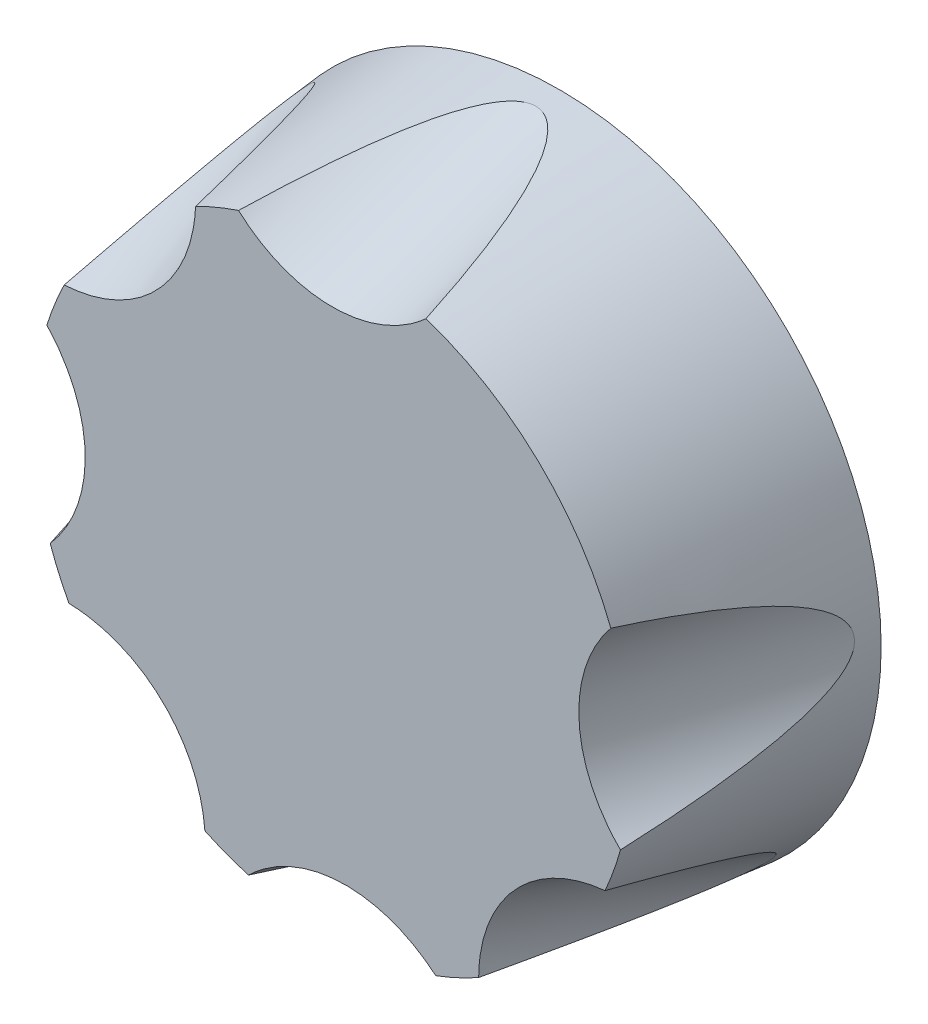
from build123d import *

# Parameters (mm, degrees)
REVOLVE1_ANGLE     = 19.5
CUT_EXTRUDE3_DEPTH = 30
REVOLVE2_ANGLE     = 19.5
CUT_EXTRUDE4_DEPTH = 30
REVOLVE3_ANGLE     = 19.5
CUT_EXTRUDE5_DEPTH = 30
REVOLVE4_ANGLE     = 19.5
CUT_EXTRUDE6_DEPTH = 30
REVOLVE5_ANGLE     = 19.5
CUT_EXTRUDE7_DEPTH = 30
REVOLVE6_ANGLE     = 19.5
CUT_EXTRUDE8_DEPTH = 30
REVOLVE7_ANGLE     = 19.5
CUT_EXTRUDE9_DEPTH = 30


# Read off the part's stored shape, not the designer's step: Boundary1
with BuildPart() as part:
    # Boundary1 outline → Boundary1 (revolve)
    with BuildSketch(Plane.XZ):
        Polygon((23.4, 0), (21.75, 16.55), (0, 16.55), (0, 0), align=None)
    revolve(axis=Axis((0, 0, 0), (0, 0, 1)))

    # Sketch3 → Revolve1 (revolve)
    with BuildSketch(Plane.XY.offset(16.55)):
        with BuildLine():
            ThreePointArc((6.7, 20.692329497), (0, 21.75), (-6.7, 20.692329497))
            ThreePointArc((-6.7, 20.692329497), (0, 18.897069907), (6.7, 20.692329497))
        make_face()
    revolve(axis=Axis((-21.75, 0, 16.55), (1, 0, 0)), revolution_arc=REVOLVE1_ANGLE)

    # Sketch21 → Cut-Extrude3 (cut)
    # profile 1 of 2: a face of its own
    with BuildSketch(Plane(origin=(0, -5.207626236, 14.705882831), x_dir=(1, 0, 0), z_dir=(0, -0.3338068592337716, 0.9426414910921781))):
        with BuildLine():
            Line((9.372530559, 28.241040631), (-9.372530559, 28.241040631))
            ThreePointArc((-9.372530559, 28.241040631), (0, 22.47450352), (9.372530559, 28.241040631))
        make_face()
        with BuildLine():
            ThreePointArc((6.7, 26.216833017), (0, 24.421573428), (-6.7, 26.216833017))
            ThreePointArc((-6.7, 26.216833017), (0, 27.27450352), (6.7, 26.216833017))
        make_face(mode=Mode.SUBTRACT)
    # profile 2 of 2: a face of its own
    with BuildSketch(Plane(origin=(0, -5.207626236, 14.705882831), x_dir=(1, 0, 0), z_dir=(0, -0.3338068592337716, 0.9426414910921781))):
        with BuildLine():
            ThreePointArc((6.7, 26.216833017), (0, 27.27450352), (-6.7, 26.216833017))
            ThreePointArc((-6.7, 26.216833017), (0, 24.421573428), (6.7, 26.216833017))
        make_face()
    extrude(amount=-CUT_EXTRUDE3_DEPTH, mode=Mode.SUBTRACT)

    # Sketch22 → Revolve2 (revolve)
    with BuildSketch(Plane.XY.offset(16.55)):
        with BuildLine():
            ThreePointArc((-19.454905378, 9.724667435), (-15.513197269, 15.244776499), (-10.062721237, 19.282223454))
            ThreePointArc((-10.062721237, 19.282223454), (-13.478343599, 13.245131366), (-19.454905378, 9.724667435))
        make_face()
    revolve(axis=Axis((-15.244776499, -15.513197269, 16.55), (0.7009092642998491, 0.7132504491541835, 0)), revolution_arc=REVOLVE2_ANGLE)

    # Sketch24 → Cut-Extrude4 (cut)
    with BuildSketch(Plane(origin=(3.714341752, -3.650073474, 14.705882831), x_dir=(0.971243492060928, 0.05687022863046558, -0.23119657485527895), z_dir=(0.23808789227923496, -0.23396832012378627, 0.9426414910921782))):
        with BuildLine():
            Line((-27.491870021, 14.371370891), (-13.585471932, 28.745378411))
            ThreePointArc((-13.585471932, 28.745378411), (-15.293280927, 16.483625521), (-27.491870021, 14.371370891))
        make_face()
    extrude(amount=-CUT_EXTRUDE4_DEPTH, mode=Mode.SUBTRACT)

    # Sketch25 → Revolve3 (revolve)
    with BuildSketch(Plane.XY.offset(16.55)):
        with BuildLine():
            ThreePointArc((-20.571898581, -7.061125177), (-21.74668737, -0.37958984), (-20.805796451, 6.338874823))
            ThreePointArc((-20.805796451, 6.338874823), (-18.893272141, -0.329783292), (-20.571898581, -7.061125177))
        make_face()
    revolve(axis=Axis((0.37958984, -21.74668737, 16.55), (-0.017452406437287054, 0.9998476951563913, 0)), revolution_arc=REVOLVE3_ANGLE)

    # Sketch26 → Cut-Extrude5 (cut)
    with BuildSketch(Plane(origin=(5.206833089, 0.09088561, 14.705882831), x_dir=(0.9426574907513692, -0.004123731024087582, -0.3337361981757048), z_dir=(0.33375601883228045, 0.00582573297890205, 0.9426414910921782))):
        with BuildLine():
            Line((-29.354887322, 9.164887842), (-30.256162535, -10.835112158))
            ThreePointArc((-30.256162535, -10.835112158), (-22.482645188, -1.165108658), (-29.354887322, 9.164887842))
        make_face()
    extrude(amount=-CUT_EXTRUDE5_DEPTH, mode=Mode.SUBTRACT)

    # Sketch27 → Revolve4 (revolve)
    with BuildSketch(Plane.XY.offset(16.55)):
        with BuildLine():
            ThreePointArc((-19.103667977, -10.397709836), (-14.971712021, -15.77689257), (-9.383651405, -19.621661151))
            ThreePointArc((-9.383651405, -19.621661151), (-13.007884538, -13.707450198), (-19.103667977, -10.397709836))
        make_face()
    revolve(axis=Axis((15.77689257, -14.971712021, 16.55), (-0.7253743710122916, 0.6883545756937498, 0)), revolution_arc=REVOLVE4_ANGLE)

    # Sketch28 → Cut-Extrude6 (cut)
    with BuildSketch(Plane(origin=(3.584693348, 3.777478605, 14.705882831), x_dir=(0.9732423250057362, -0.05845929079288866, -0.22222035941250265), z_dir=(0.2297774789515262, 0.24213494055628595, 0.9426414910921781))):
        with BuildLine():
            Line((-26.325903264, -15.059910067), (-12.852307992, -29.840377936))
            ThreePointArc((-12.852307992, -29.840377936), (-14.195389298, -17.533334095), (-26.325903264, -15.059910067))
        make_face()
    extrude(amount=-CUT_EXTRUDE6_DEPTH, mode=Mode.SUBTRACT)

    # Sketch29 → Revolve5 (revolve)
    with BuildSketch(Plane.XY.offset(16.55)):
        with BuildLine():
            ThreePointArc((-5.973766656, -20.913550917), (0.759064053, -21.736750488), (7.418070426, -20.445897661))
            ThreePointArc((7.418070426, -20.445897661), (0.659498229, -18.885558323), (-5.973766656, -20.913550917))
        make_face()
    revolve(axis=Axis((21.736750488, 0.759064053, 16.55), (-0.9993908270190959, -0.03489949670249739, 0)), revolution_arc=REVOLVE5_ANGLE)

    # Sketch30 → Cut-Extrude7 (cut)
    with BuildSketch(Plane(origin=(-0.181743535, 5.204453891, 14.705882831), x_dir=(0.9999321399924122, 0.0038771729275817748, 0.01098557874146117), z_dir=(-0.011649691383100024, 0.33360351311428743, 0.9426414910921777))):
        with BuildLine():
            Line((-9.086281711, -30.342992304), (10.880145152, -29.184632107))
            ThreePointArc((10.880145152, -29.184632107), (0.474220724, -22.477625897), (-9.086281711, -30.342992304))
        make_face()
    extrude(amount=-CUT_EXTRUDE7_DEPTH, mode=Mode.SUBTRACT)

    # Sketch31 → Revolve6 (revolve)
    with BuildSketch(Plane.XY.offset(16.55)):
        with BuildLine():
            ThreePointArc((19.782439975, -9.039777024), (16.035782076, -14.694087016), (10.729531193, -18.919293337))
            ThreePointArc((10.729531193, -18.919293337), (13.932381375, -12.766675382), (19.782439975, -9.039777024))
        make_face()
    revolve(axis=Axis((14.694087016, 16.035782076, 16.55), (-0.675590207615664, -0.7372773368101205, 0)), revolution_arc=REVOLVE6_ANGLE)

    # Sketch32 → Cut-Extrude8 (cut)
    with BuildSketch(Plane(origin=(-3.839464802, 3.51822129, 14.705882831), x_dir=(0.9692386501510535, 0.054574384261441185, 0.23999599087453166), z_dir=(-0.2461082321848259, 0.22551664533327645, 0.9426414910921782))):
        with BuildLine():
            Line((15.221586992, -29.008248881), (27.126990078, -12.937736215))
            ThreePointArc((27.126990078, -12.937736215), (15.309806614, -16.628450305), (15.221586992, -29.008248881))
        make_face()
    extrude(amount=-CUT_EXTRUDE8_DEPTH, mode=Mode.SUBTRACT)

    # Sketch33 → Revolve7 (revolve)
    with BuildSketch(Plane.XY.offset(16.55)):
        with BuildLine():
            ThreePointArc((20.313320471, 7.773770734), (21.720192381, 1.138307048), (21.014622285, -5.607865032))
            ThreePointArc((21.014622285, -5.607865032), (18.87117213, 0.988996224), (20.313320471, 7.773770734))
        make_face()
    revolve(axis=Axis((-1.138307048, 21.720192381, 16.55), (0.052335956242940865, -0.998629534754574, 0)), revolution_arc=REVOLVE7_ANGLE)

    # Sketch34 → Cut-Extrude9 (cut)
    with BuildSketch(Plane(origin=(-5.200489365, -0.272546099, 14.705882831), x_dir=(0.9427855723268154, -0.012319387513152558, 0.3331720235909673), z_dir=(-0.33334938853450696, -0.01747010117845218, 0.9426414910921781))):
        with BuildLine():
            Line((28.876049562, 11.693707416), (30.572326937, -8.234228831))
            ThreePointArc((30.572326937, -8.234228831), (22.452048009, 1.11073054), (28.876049562, 11.693707416))
        make_face()
    extrude(amount=-CUT_EXTRUDE9_DEPTH, mode=Mode.SUBTRACT)


solid = part.part
